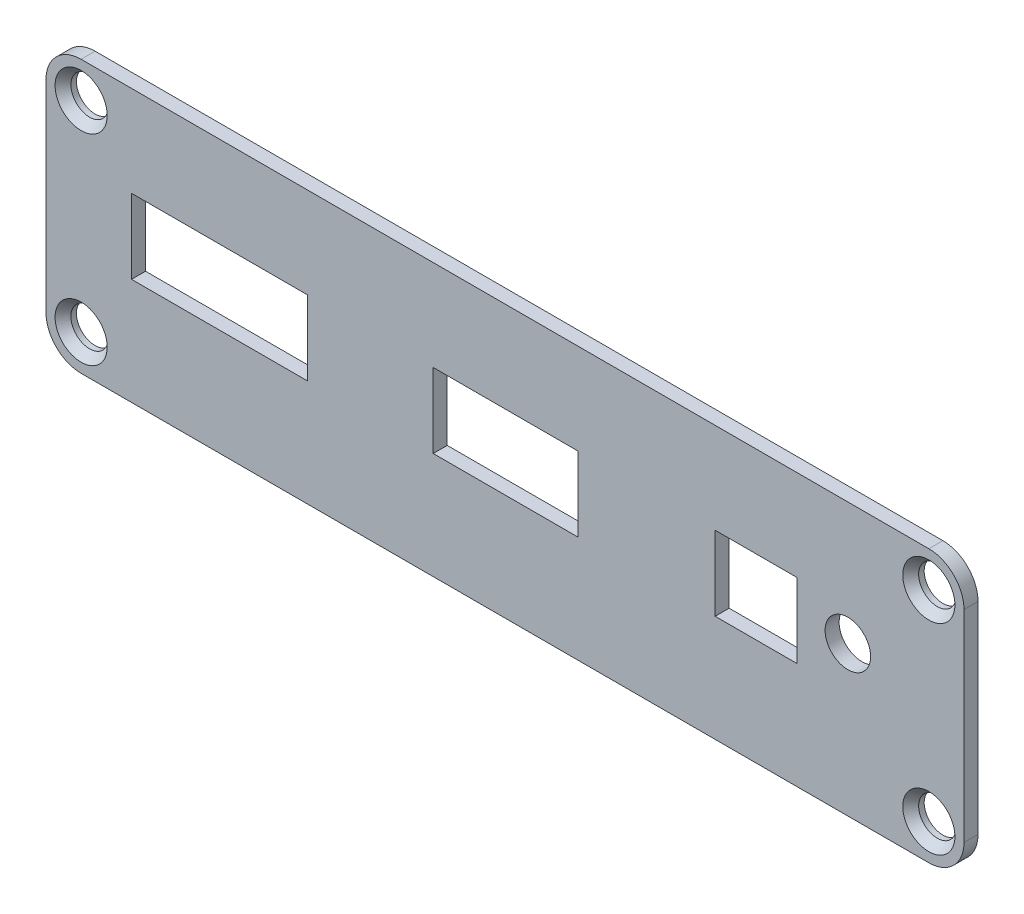
from build123d import *

# Parameters (mm, degrees)
SKETCH1_W                                     = 102.87
SKETCH1_H                                     = 30.48
BOSS_EXTRUDE1_DEPTH                           = 1.57
FILLET1_R                                     = 3.935
CSK_FOR_6_FLAT_HEAD_MACHINE_SCREW1_AT_2_COUNT = 2
CSK_FOR_6_FLAT_HEAD_MACHINE_SCREW1_AT_2_PITCH = 22.479
CSK_FOR_6_FLAT_HEAD_MACHINE_SCREW1_AT_3_COUNT = 2
CSK_FOR_6_FLAT_HEAD_MACHINE_SCREW1_AT_3_PITCH = 94.996
CSK_FOR_6_FLAT_HEAD_MACHINE_SCREW1_AT_4_COUNT = 2
CSK_FOR_6_FLAT_HEAD_MACHINE_SCREW1_AT_4_PITCH = 97.619390784
SKETCH6_R                                     = 2.15
SKETCH6_W                                     = 8.4
SKETCH6_H                                     = 7.55
SKETCH6_W_2                                   = 15.4
SKETCH6_W_3                                   = 18.9
CUT_EXTRUDE1_DEPTH                            = 108.302060558
MOVE_FACE1_BY                                 = 0.4
MOVE_FACE1_2_BY                               = 0.4
MOVE_FACE1_3_BY                               = 0.4
MOVE_FACE1_4_BY                               = 0.4
MOVE_FACE1_5_BY                               = 0.4
MOVE_FACE1_6_BY                               = 0.4
MOVE_FACE1_7_BY                               = 0.4
MOVE_FACE1_8_BY                               = 0.4
MOVE_FACE1_9_BY                               = 0.4
MOVE_FACE1_10_BY                              = 0.4
MOVE_FACE1_11_BY                              = 0.4
MOVE_FACE1_12_BY                              = 0.4
MOVE_FACE1_13_BY                              = 0.4


with BuildPart() as part:
    # Sketch1 → Boss-Extrude1 (new body)
    with BuildSketch(Plane.XY):
        with Locations((51.435, 15.24)):
            Rectangle(SKETCH1_W, SKETCH1_H)
    extrude(amount=BOSS_EXTRUDE1_DEPTH)

    # Fillet1
    fillet1_edges = [part.edges().sort_by_distance(p)[0] for p in [
        (0, 0, 0.785),
        (102.87, 0, 0.785),
        (102.87, 30.48, 0.785),
        (0, 30.48, 0.785),
    ]]
    fillet(fillet1_edges, radius=FILLET1_R)

    # Sketch4 → CSK for #6 Flat Head Machine Screw1 (revolve, cut)
    with BuildSketch(Plane(origin=(3.937, 26.4795, 1.57), x_dir=(0, -1, 0), z_dir=(1, 0, 0))):
        Polygon((0, 0), (0, 1.57), (2.0955, 1.57), (2.0955, 0.94962912), (2.921, 0), align=None)
    csk_for_6_flat_head_machine_screw1 = revolve(axis=Axis((3.937, 26.4795, 7.92), (0, 0, -1)), mode=Mode.SUBTRACT)

    # CSK for #6 Flat Head Machine Screw1 at 2: CSK for #6 Flat Head Machine Screw1 ×2
    with Locations(*[(0, -i * CSK_FOR_6_FLAT_HEAD_MACHINE_SCREW1_AT_2_PITCH, 0) for i in range(1, CSK_FOR_6_FLAT_HEAD_MACHINE_SCREW1_AT_2_COUNT)]):
        add(csk_for_6_flat_head_machine_screw1, mode=Mode.SUBTRACT)

    # CSK for #6 Flat Head Machine Screw1 at 3: CSK for #6 Flat Head Machine Screw1 ×2
    with Locations(*[(i * CSK_FOR_6_FLAT_HEAD_MACHINE_SCREW1_AT_3_PITCH, 0, 0) for i in range(1, CSK_FOR_6_FLAT_HEAD_MACHINE_SCREW1_AT_3_COUNT)]):
        add(csk_for_6_flat_head_machine_screw1, mode=Mode.SUBTRACT)

    # CSK for #6 Flat Head Machine Screw1 at 4: CSK for #6 Flat Head Machine Screw1 ×2
    with Locations(*[Vector(0.9731263352215668, -0.23027187344146696, 0) * (i * CSK_FOR_6_FLAT_HEAD_MACHINE_SCREW1_AT_4_PITCH) for i in range(1, CSK_FOR_6_FLAT_HEAD_MACHINE_SCREW1_AT_4_COUNT)]):
        add(csk_for_6_flat_head_machine_screw1, mode=Mode.SUBTRACT)

    # Sketch6 → Cut-Extrude1 (cut, through all)
    with BuildSketch(Plane.XY.offset(1.57)):
        with Locations((89.85634518, 16.74780981)):
            Circle(SKETCH6_R)
        with Locations((79.585, 16.1245)):
            Rectangle(SKETCH6_W, SKETCH6_H)
        with Locations((51.49, 16.1245)):
            Rectangle(SKETCH6_W_2, SKETCH6_H)
        with Locations((19.43498277, 16.1245)):
            Rectangle(SKETCH6_W_3, SKETCH6_H)
    extrude(amount=-CUT_EXTRUDE1_DEPTH, mode=Mode.SUBTRACT)

    # Move Face1: a face moved inward by 0.4
    extrude(part.faces().sort_by_distance((19.43498277, 12.3495, 0.785))[0], amount=MOVE_FACE1_BY, dir=(0, -1, 0), mode=Mode.SUBTRACT)

    # Move Face1 2: a face moved inward by 0.4
    extrude(part.faces().sort_by_distance((51.49, 12.3495, 0.785))[0], amount=MOVE_FACE1_2_BY, dir=(0, -1, 0), mode=Mode.SUBTRACT)

    # Move Face1 3: a face moved inward by 0.4
    extrude(part.faces().sort_by_distance((79.585, 12.3495, 0.785))[0], amount=MOVE_FACE1_3_BY, dir=(0, -1, 0), mode=Mode.SUBTRACT)

    # Move Face1 4: a curved face moved inward by 0.4
    add(Solid.thicken(part.faces().sort_by_distance((87.70634518, 16.74780981, 0.785))[0], -MOVE_FACE1_4_BY), mode=Mode.SUBTRACT)

    # Move Face1 5: a face moved inward by 0.4
    extrude(part.faces().sort_by_distance((19.43498277, 19.8995, 0.785))[0], amount=MOVE_FACE1_5_BY, dir=(0, 1, 0), mode=Mode.SUBTRACT)

    # Move Face1 6: a face moved inward by 0.4
    extrude(part.faces().sort_by_distance((51.49, 19.8995, 0.785))[0], amount=MOVE_FACE1_6_BY, dir=(0, 1, 0), mode=Mode.SUBTRACT)

    # Move Face1 7: a face moved inward by 0.4
    extrude(part.faces().sort_by_distance((79.585, 19.8995, 0.785))[0], amount=MOVE_FACE1_7_BY, dir=(0, 1, 0), mode=Mode.SUBTRACT)

    # Move Face1 8: a face moved inward by 0.4
    extrude(part.faces().sort_by_distance((75.385, 16.1245, 0.785))[0], amount=MOVE_FACE1_8_BY, dir=(-1, 0, 0), mode=Mode.SUBTRACT)

    # Move Face1 9: a face moved inward by 0.4
    extrude(part.faces().sort_by_distance((83.785, 16.1245, 0.785))[0], amount=MOVE_FACE1_9_BY, dir=(1, 0, 0), mode=Mode.SUBTRACT)

    # Move Face1 10: a face moved inward by 0.4
    extrude(part.faces().sort_by_distance((59.19, 16.1245, 0.785))[0], amount=MOVE_FACE1_10_BY, dir=(1, 0, 0), mode=Mode.SUBTRACT)

    # Move Face1 11: a face moved inward by 0.4
    extrude(part.faces().sort_by_distance((28.88498277, 16.1245, 0.785))[0], amount=MOVE_FACE1_11_BY, dir=(1, 0, 0), mode=Mode.SUBTRACT)

    # Move Face1 12: a face moved inward by 0.4
    extrude(part.faces().sort_by_distance((9.98498277, 16.1245, 0.785))[0], amount=MOVE_FACE1_12_BY, dir=(-1, 0, 0), mode=Mode.SUBTRACT)

    # Move Face1 13: a face moved inward by 0.4
    extrude(part.faces().sort_by_distance((43.79, 16.1245, 0.785))[0], amount=MOVE_FACE1_13_BY, dir=(-1, 0, 0), mode=Mode.SUBTRACT)


solid = part.part
